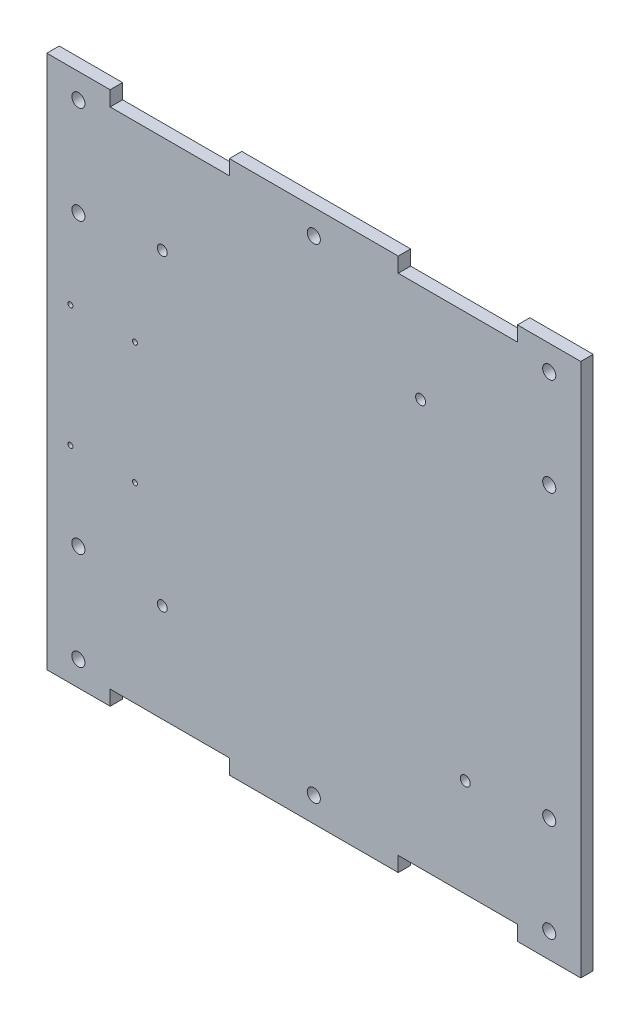
from build123d import *

# Parameters (mm, degrees)
SKETCH2_W                = 273.05
SKETCH2_H                = 273.05
SKETCH2_R                = 3.35
BOSS_EXTRUDE1_DEPTH      = 6.35
SKETCH3_W                = 60.96
SKETCH3_H                = 17.280059867
CUT_EXTRUDE1_DEPTH       = 194.179899964
SKETCH4_R                = 2.54
ITX_MOUNTING_HOLES_DEPTH = 194.179899964
SKETCH5_R                = 1.27
CUT_EXTRUDE2_DEPTH       = 194.179899964


with BuildPart() as part:
    # Sketch2 → Boss-Extrude1 (new body)
    with BuildSketch(Plane.XY):
        Rectangle(SKETCH2_W, SKETCH2_H)
        with Locations((-120.396, 123.825)):
            Circle(SKETCH2_R, mode=Mode.SUBTRACT)
        with Locations((-120.396, 73.787)):
            Circle(SKETCH2_R, mode=Mode.SUBTRACT)
        with Locations((0, 123.825)):
            Circle(SKETCH2_R, mode=Mode.SUBTRACT)
        with Locations((120.396, 73.787)):
            Circle(SKETCH2_R, mode=Mode.SUBTRACT)
        with Locations((120.396, 123.825)):
            Circle(SKETCH2_R, mode=Mode.SUBTRACT)
        with Locations((120.396, -123.825)):
            Circle(SKETCH2_R, mode=Mode.SUBTRACT)
        with Locations((120.396, -73.787)):
            Circle(SKETCH2_R, mode=Mode.SUBTRACT)
        with Locations((0, -123.825)):
            Circle(SKETCH2_R, mode=Mode.SUBTRACT)
        with Locations((-120.396, -73.787)):
            Circle(SKETCH2_R, mode=Mode.SUBTRACT)
        with Locations((-120.396, -123.825)):
            Circle(SKETCH2_R, mode=Mode.SUBTRACT)
    extrude(amount=BOSS_EXTRUDE1_DEPTH)

    # Sketch3 → Cut-Extrude1 (cut, through all)
    with BuildSketch(Plane.XY.offset(6.35)):
        with Locations((73.66, 137.545029934)):
            Rectangle(SKETCH3_W, SKETCH3_H)
        with Locations((-73.66, 137.545029934)):
            Rectangle(SKETCH3_W, SKETCH3_H)
        with Locations((-73.66, -137.545029934)):
            Rectangle(SKETCH3_W, SKETCH3_H)
        with Locations((73.66, -137.545029934)):
            Rectangle(SKETCH3_W, SKETCH3_H)
    extrude(amount=-CUT_EXTRUDE1_DEPTH, mode=Mode.SUBTRACT)

    # Sketch4 → ITX_mounting_Holes (cut, through all)
    with BuildSketch(Plane.XY.offset(6.35)):
        with Locations((-77.47, 78.74)):
            Circle(SKETCH4_R)
        with Locations((-77.47, -78.74)):
            Circle(SKETCH4_R)
        with Locations((77.47, -78.74)):
            Circle(SKETCH4_R)
        with Locations((54.61, 78.74)):
            Circle(SKETCH4_R)
    extrude(amount=-ITX_MOUNTING_HOLES_DEPTH, mode=Mode.SUBTRACT)

    # Sketch5 → Cut-Extrude2 (cut, through all)
    with BuildSketch(Plane.XY.offset(6.35)):
        with Locations((-124.46, 31.115)):
            Circle(SKETCH5_R)
        with Locations((-91.44, 31.115)):
            Circle(SKETCH5_R)
        with Locations((-91.44, -31.115)):
            Circle(SKETCH5_R)
        with Locations((-124.46, -31.115)):
            Circle(SKETCH5_R)
    extrude(amount=-CUT_EXTRUDE2_DEPTH, mode=Mode.SUBTRACT)


solid = part.part
